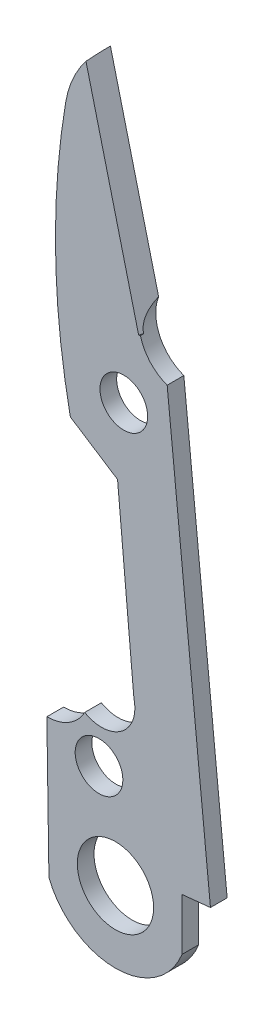
from build123d import *

# Parameters (mm, degrees)
SKETCH1_R           = 1.27
BOSS_EXTRUDE3_DEPTH = 0.889
SKETCH3_R           = 2.032
CUT_EXTRUDE1_DEPTH  = 83.604924224
CUT_EXTRUDE2_DEPTH  = 12.7


with BuildPart() as part:
    # Sketch1 → Boss-Extrude3 (new body)
    with BuildSketch(Plane.XY):
        with BuildLine():
            Line((53.996625603, 56.542994194), (56.56360068, 46.264500713))
            ThreePointArc((56.56360068, 46.264500713), (56.615044517, 44.500180003), (57.90781187, 43.298420207))
            Line((57.90781187, 43.298420207), (60.213561534, 20.356500713))
            Line((60.213561534, 20.356500713), (58.69720068, 20.204100713))
            Line((58.69720068, 20.204100713), (58.69720068, 17.435500713))
            ThreePointArc((58.69720068, 17.435500713), (55.15390068, 15.02590248), (51.61060068, 17.435500713))
            Line((51.61060068, 17.435500713), (51.500193415, 24.801500713))
            ThreePointArc((51.500193415, 24.801500713), (52.674827813, 25.126370929), (53.51560068, 26.008645044))
            ThreePointArc((53.51560068, 26.008645044), (55.478305908, 26.122647996), (56.136100356, 27.975352761))
            Line((56.136100356, 27.975352761), (55.265438284, 37.628500713))
            Line((55.265438284, 37.628500713), (52.75204602, 39.254100713))
            ThreePointArc((52.75204602, 39.254100713), (51.963084154, 46.430663208), (52.49960068, 53.630500713))
            ThreePointArc((52.49960068, 53.630500713), (53.021713072, 55.203117343), (53.996625603, 56.542994194))
        make_face()
        with Locations((55.59840068, 41.336900713)):
            Circle(SKETCH1_R, mode=Mode.SUBTRACT)
        with Locations((54.27760068, 23.912500713)):
            Circle(SKETCH1_R, mode=Mode.SUBTRACT)
    extrude(amount=BOSS_EXTRUDE3_DEPTH)

    # Sketch3 → Cut-Extrude1 (cut, through all)
    with BuildSketch(Plane.XY.offset(0.889)):
        with Locations((55.15390068, 18.83590248)):
            Circle(SKETCH3_R)
    extrude(amount=-CUT_EXTRUDE1_DEPTH, mode=Mode.SUBTRACT)

    # Sketch4 → Cut-Extrude2 (cut)
    with BuildSketch(Plane(origin=(-10.309852374, 41.281955301, 0), x_dir=(0.9702012895028557, 0.24230034636169281, 0), z_dir=(-0.24230034636169281, 0.9702012895028557, 0))):
        Polygon((66.087982866, 0), (66.087982866, -0.889), (65.574718477, -0.889), align=None)
    extrude(amount=-CUT_EXTRUDE2_DEPTH, mode=Mode.SUBTRACT)


solid = part.part
